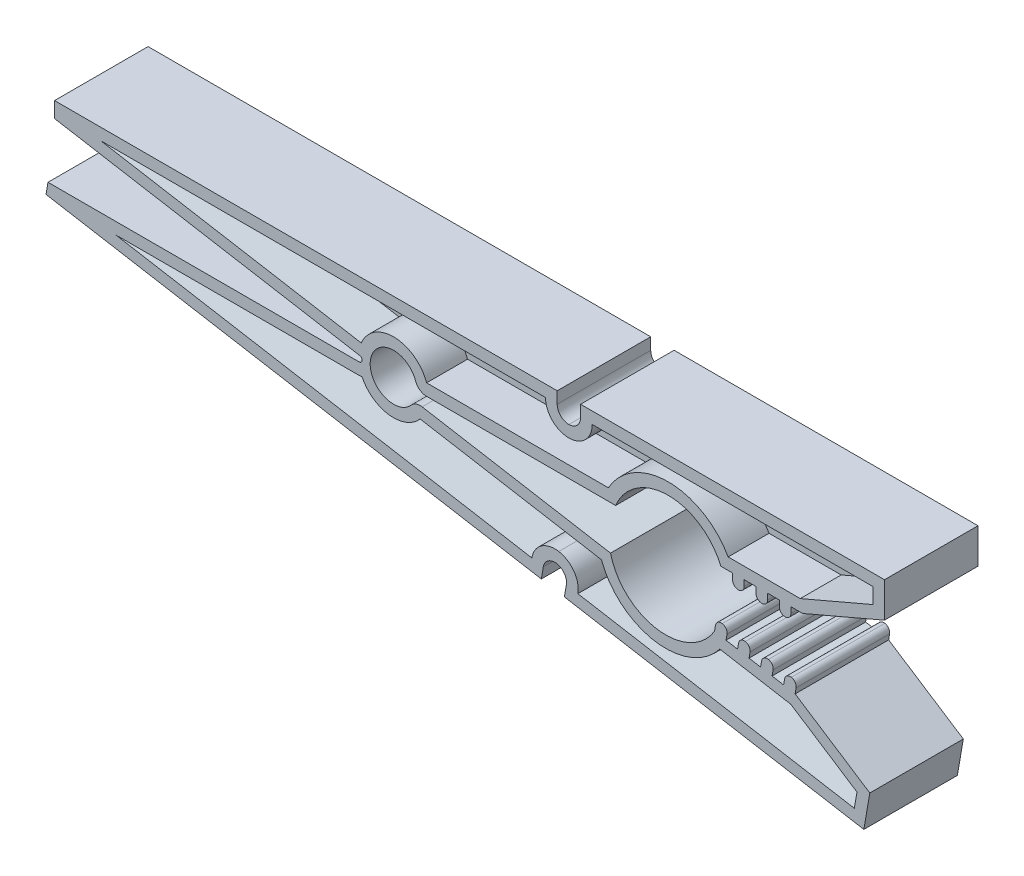
from build123d import *

# Parameters (mm, degrees)
BRUTO_GRAMPO_1_START   = -4
BRUTO_GRAMPO_1_DEPTH   = 8
BRUTO_GRAMPO_1_START_2 = -0.5
BRUTO_GRAMPO_1_2_DEPTH = 1
ESCALA1_SCALE          = 1.015


# Read off the part's stored shape, not the designer's step: Bruto-Grampo-1
with BuildPart() as part:
    # Bruto-Grampo-1 outline → Bruto-Grampo-1 (new body)
    with BuildSketch(Plane.XY.offset(BRUTO_GRAMPO_1_START)):
        with BuildLine():
            Line((63, -6), (64, -6))
            Line((64, -6), (71, -3))
            Line((71, -3), (71, 0))
            Line((71, 0), (45, 0))
            Line((45, 0), (45, -1))
            ThreePointArc((45, -1), (44.707106781, -1.707106781), (44, -2))
            ThreePointArc((44, -2), (43.292893219, -1.707106781), (43, -1))
            Line((43, -1), (43, 0))
            Line((43, 0), (0, 0))
            Line((0, 0), (0, -1.335144068))
            Line((0, -1.335144068), (26.146588044, -5.84317649))
            ThreePointArc((26.146588044, -5.84317649), (26.311379183, -6.124884785), (26.061766048, -6.335144068))
            Line((26.061766048, -6.335144068), (-0.562908784, -6.335144068))
            Line((-0.562908784, -6.335144068), (-0.732815701, -7.320604184))
            Line((-0.732815701, -7.320604184), (41.641969276, -14.626601592))
            Line((41.641969276, -14.626601592), (41.811876193, -13.641141477))
            ThreePointArc((41.811876193, -13.641141477), (42.220653111, -12.99408053), (42.967243225, -12.825588277))
            ThreePointArc((42.967243225, -12.825588277), (43.614304172, -13.234365196), (43.782796424, -13.98095531))
            Line((43.782796424, -13.98095531), (43.612889508, -14.966415425))
            Line((43.612889508, -14.966415425), (69.234852518, -19.383995254))
            Line((69.234852518, -19.383995254), (69.744573267, -16.427614907))
            Line((69.744573267, -16.427614907), (63.356073202, -12.281886143))
            Line((63.356073202, -12.281886143), (63.44102666, -11.789156085))
            ThreePointArc((63.44102666, -11.789156085), (63.356780534, -11.415861028), (63.03325006, -11.211472569))
            ThreePointArc((63.03325006, -11.211472569), (62.659955003, -11.295718696), (62.455566544, -11.619249169))
            Line((62.455566544, -11.619249169), (62.370613086, -12.111979227))
            Line((62.370613086, -12.111979227), (61.38515297, -11.94207231))
            Line((61.38515297, -11.94207231), (61.470106428, -11.449342252))
            ThreePointArc((61.470106428, -11.449342252), (61.385860302, -11.076047195), (61.062329829, -10.871658736))
            ThreePointArc((61.062329829, -10.871658736), (60.689034772, -10.955904863), (60.484646313, -11.279435336))
            Line((60.484646313, -11.279435336), (60.399692854, -11.772165394))
            Line((60.399692854, -11.772165394), (59.414232739, -11.602258477))
            Line((59.414232739, -11.602258477), (59.499186197, -11.109528419))
            ThreePointArc((59.499186197, -11.109528419), (59.414940071, -10.736233362), (59.091409597, -10.531844903))
            ThreePointArc((59.091409597, -10.531844903), (58.71811454, -10.61609103), (58.513726081, -10.939621503))
            Line((58.513726081, -10.939621503), (58.428772623, -11.432351561))
            Line((58.428772623, -11.432351561), (57.443312507, -11.262444644))
            Line((57.443312507, -11.262444644), (57.528265965, -10.769714587))
            ThreePointArc((57.528265965, -10.769714587), (57.444019839, -10.39641953), (57.120489366, -10.19203107))
            ThreePointArc((57.120489366, -10.19203107), (56.747194309, -10.276277197), (56.54280585, -10.59980767))
            Line((56.54280585, -10.59980767), (56.457852391, -11.092537728))
            ThreePointArc((56.457852391, -11.092537728), (51.559018801, -13.393037449), (47.558931741, -9.747468492))
            Line((47.558931741, -9.747468492), (31.445619908, -6.969311252))
            ThreePointArc((31.445619908, -6.969311252), (30.937336598, -7.013760518), (30.517142023, -7.303180937))
            ThreePointArc((30.517142023, -7.303180937), (27.034098374, -5.632261947), (30.885618205, -5.333333319))
            ThreePointArc((30.885618205, -5.333333319), (31.251076976, -5.816496576), (31.828427251, -5.999999999))
            Line((31.828427251, -5.999999999), (48, -5.999999999))
            ThreePointArc((48, -5.999999999), (52.5, -2.993196129), (57, -6))
            Line((57, -6), (58, -6))
            Line((58, -6), (58, -6.5))
            ThreePointArc((58, -6.5), (58.146446609, -6.853553391), (58.5, -7))
            ThreePointArc((58.5, -7), (58.853553391, -6.853553391), (59, -6.5))
            Line((59, -6.5), (59, -6))
            Line((59, -6), (60, -6))
            Line((60, -6), (60, -6.5))
            ThreePointArc((60, -6.5), (60.146446609, -6.853553391), (60.5, -7))
            ThreePointArc((60.5, -7), (60.853553391, -6.853553391), (61, -6.5))
            Line((61, -6.5), (61, -6))
            Line((61, -6), (62, -6))
            Line((62, -6), (62, -6.5))
            ThreePointArc((62, -6.5), (62.146446609, -6.853553391), (62.5, -7))
            ThreePointArc((62.5, -7), (62.853553391, -6.853553391), (63, -6.5))
            Line((63, -6.5), (63, -6))
        make_face()
        with BuildLine():
            Line((68.419299318, -18.228628222), (44.76825654, -14.150862226))
            ThreePointArc((44.76825654, -14.150862226), (44.431272035, -12.657681998), (43.137150142, -11.840128162))
            ThreePointArc((43.137150142, -11.840128162), (41.643969914, -12.177112667), (40.826416077, -13.47123456))
            Line((40.826416077, -13.47123456), (5.237091217, -7.335144068))
            Line((5.237091217, -7.335144068), (26.061766048, -7.335144068))
            ThreePointArc((26.061766048, -7.335144068), (26.18246919, -7.329318154), (26.302050161, -7.311894575))
            ThreePointArc((26.302050161, -7.311894575), (28.615430589, -8.975249078), (31.27571299, -7.954771367))
            Line((31.27571299, -7.954771367), (46.78652147, -10.629048718))
            ThreePointArc((46.78652147, -10.629048718), (51.394904099, -14.37957122), (56.91703012, -12.186460714))
            Line((56.91703012, -12.186460714), (62.983893007, -13.232471556))
            Line((62.983893007, -13.232471556), (68.647077183, -16.907516604))
            Line((68.647077183, -16.907516604), (68.419299318, -18.228628222))
        make_face(mode=Mode.SUBTRACT)
        with BuildLine():
            ThreePointArc((31.828427251, -4.999999999), (29.084046667, -3.001177418), (26.232021768, -4.84315203))
            Line((26.232021768, -4.84315203), (3.941739992, -1))
            Line((3.941739992, -1), (42, -1))
            ThreePointArc((42, -1), (42.585786438, -2.414213562), (44, -3))
            ThreePointArc((44, -3), (45.414213562, -2.414213562), (46, -1))
            Line((46, -1), (70, -1))
            Line((70, -1), (70, -2.340603842))
            Line((70, -2.340603842), (63.794742298, -5))
            Line((63.794742298, -5), (57.624803191, -5))
            ThreePointArc((57.624803191, -5), (52.500000001, -1.993196129), (47.37519681, -4.999999999))
            Line((47.37519681, -4.999999999), (31.828427251, -4.999999999))
        make_face(mode=Mode.SUBTRACT)
    extrude(amount=BRUTO_GRAMPO_1_DEPTH)

    # Bruto-Grampo-1 2 outline → Bruto-Grampo-1 2 (add)
    with BuildSketch(Plane.XY.offset(BRUTO_GRAMPO_1_START_2)):
        with BuildLine():
            ThreePointArc((43.137150142, -11.840128162), (44.431272035, -12.657681998), (44.76825654, -14.150862226))
            Line((44.76825654, -14.150862226), (68.419299318, -18.228628222))
            Line((68.419299318, -18.228628222), (68.647077183, -16.907516604))
            Line((68.647077183, -16.907516604), (62.983893007, -13.232471556))
            Line((62.983893007, -13.232471556), (56.91703012, -12.186460714))
            ThreePointArc((56.91703012, -12.186460714), (51.394904099, -14.37957122), (46.78652147, -10.629048718))
            Line((46.78652147, -10.629048718), (31.27571299, -7.954771367))
            ThreePointArc((31.27571299, -7.954771367), (28.615430589, -8.975249078), (26.302050161, -7.311894575))
            ThreePointArc((26.302050161, -7.311894575), (26.18246919, -7.329318154), (26.061766048, -7.335144068))
            Line((26.061766048, -7.335144068), (5.237091217, -7.335144068))
            Line((5.237091217, -7.335144068), (40.826416077, -13.47123456))
            ThreePointArc((40.826416077, -13.47123456), (41.643969914, -12.177112667), (43.137150142, -11.840128162))
        make_face()
        with BuildLine():
            Line((3.941739992, -1), (26.232021768, -4.84315203))
            ThreePointArc((26.232021768, -4.84315203), (29.084046667, -3.001177418), (31.828427251, -4.999999999))
            Line((31.828427251, -4.999999999), (47.37519681, -4.999999999))
            ThreePointArc((47.37519681, -4.999999999), (52.500000001, -1.993196129), (57.624803191, -5))
            Line((57.624803191, -5), (63.794742298, -5))
            Line((63.794742298, -5), (70, -2.340603842))
            Line((70, -2.340603842), (70, -1))
            Line((70, -1), (46, -1))
            ThreePointArc((46, -1), (45.414213562, -2.414213562), (44, -3))
            ThreePointArc((44, -3), (42.585786438, -2.414213562), (42, -1))
            Line((42, -1), (3.941739992, -1))
        make_face()
    extrude(amount=BRUTO_GRAMPO_1_2_DEPTH)


with BuildPart() as part_1:
    # Escala1: scaled about (37.195426372, -6.887443952, 0)
    add(part.part.scale(ESCALA1_SCALE).moved(Location((-0.557931396, 0.103311659, 0))))


solid = part_1.part
